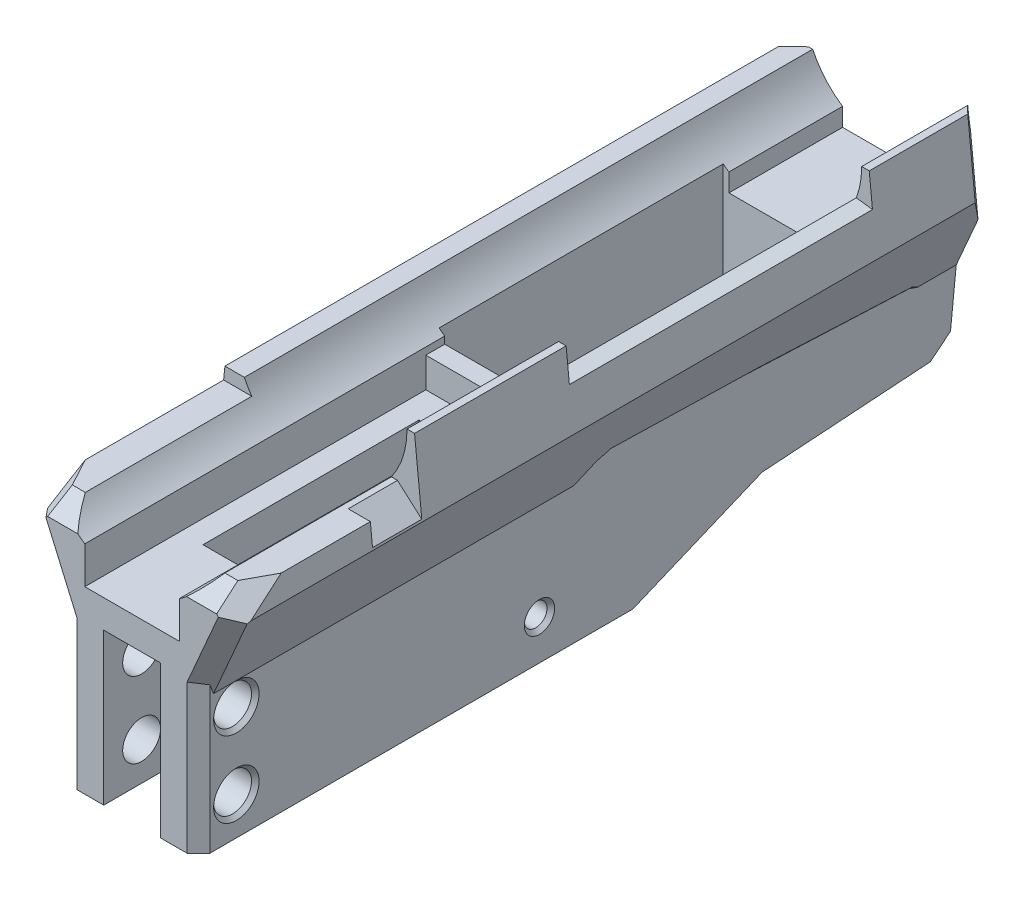
from build123d import *
from OCP.BRepFilletAPI import BRepFilletAPI_MakeChamfer

# Parameters (mm, degrees)
EXTRUDE_1_DEPTH           = 90
SKETCH_3_W                = 13
SKETCH_3_H                = 57
CUT_EXTRUDE_1_DEPTH       = 45
CUT_EXTRUDE_2_REACH       = 121.225
SKETCH_4_W                = 13
SKETCH_4_H                = 26
CHAMFER_1_SIZE            = 3
CUT_EXTRUDE_3_DEPTH       = 121.740424051
CUT_EXTRUDE_3_DEPTH_BACK  = 121.740424051
SKETCH_5_W                = 50
SKETCH_5_H                = 13
CUT_EXTRUDE_5_DEPTH       = 13
EXTRUDE_START             = 80
EXTRUDE_3_DEPTH           = 80
EXTRUDE_START_2           = 30
EXTRUDE_4_DEPTH           = 30
CUT_EXTRUDE_7_REACH       = 138.302
SKETCH_13_W               = 28
SKETCH_13_H               = 75
SKETCH_14_W               = 10
SKETCH_14_H               = 29.16112988
CUT_EXTRUDE_8_DEPTH       = 5
SKETCH_15_R               = 2
CUT_EXTRUDE_9_DEPTH       = 141.755106479
SKETCH_16_R               = 3
CUT_EXTRUDE_10_DEPTH      = 14
CUT_EXTRUDE_START         = -14
SKETCH_17_R               = 3
CUT_EXTRUDE_11_DEPTH      = 14
CUT_EXTRUDE_12_DEPTH      = 137.302054277
CUT_EXTRUDE_12_DEPTH_BACK = 137.302054277
CHAMFER_2_SIZE            = 4.4
CHAMFER_2_SIZE2           = 6.05608045
CUT_EXTRUDE_13_DEPTH      = 10
CHAMFER_3_SIZE            = 2
CHAMFER_4_SIZE            = 4
CHAMFER_4_SIZE2           = 4.917507249
CHAMFER_5_SIZE            = 4
CHAMFER_5_EDGE_2_SIZE     = 4
CHAMFER_5_EDGE_3_SIZE     = 4
CHAMFER_5_EDGE_3_SIZE2    = 4.372547618
CHAMFER_5_EDGE_4_SIZE     = 4
CHAMFER_5_EDGE_4_SIZE2    = 4.372547618
CHAMFER_5_EDGE_5_SIZE     = 4
CHAMFER_5_EDGE_6_SIZE     = 4
SKETCH_25_W               = 20
SKETCH_25_H               = 40
CUT_EXTRUDE_14_DEPTH      = 7.5
SKETCH_26_R               = 5
SKETCH_26_W               = 15
SKETCH_26_H               = 10
CUT_EXTRUDE_15_DEPTH      = 20
CHAMFER_6_SIZE            = 1
CHAMFER_6_SIZE2           = 0.909876415
SKETCH_28_R               = 5
CUT_EXTRUDE_16_DEPTH      = 141.755106479
CHAMFER_7_SIZE            = 1
CHAMFER_8_SIZE            = 3


# Some blends are built 0.0001 mm under size
with BuildPart() as part:
    # 스케치2 → 보스-돌출1 (new body)
    with BuildSketch(Plane.XY):
        with BuildLine():
            ThreePointArc((20.380730277, -9.650302243), (17.060788125, -14.745575898), (12.5, -18.768390981))
            Line((12.5, -18.768390981), (12.5, -28.568390981))
            Line((12.5, -28.568390981), (-12.5, -28.568390981))
            Line((-12.5, -28.568390981), (-12.5, -18.768390981))
            ThreePointArc((-12.5, -18.768390981), (-17.060788125, -14.745575898), (-20.380730277, -9.650302243))
            Line((-20.380730277, -9.650302243), (-25.518665511, -9.650302243))
            Line((-25.518665511, -9.650302243), (-26.5, -19.300604486))
            Line((-26.5, -19.300604486), (-17.5, -40))
            Line((-17.5, -40), (-17.5, -76))
            Line((-17.5, -76), (17.5, -76))
            Line((17.5, -76), (17.5, -40))
            Line((17.5, -40), (26.5, -19.300604486))
            Line((26.5, -19.300604486), (24.537331021, 0))
            Line((24.537331021, 0), (22.55, 0))
            ThreePointArc((22.55, 0), (22.000999611, -4.945555189), (20.380730277, -9.650302243))
        make_face()
    extrude(amount=EXTRUDE_1_DEPTH)

    # 스케치3 → 컷-돌출1 (cut)
    with BuildSketch(Plane(origin=(0, -28.568390981, 0), x_dir=(1, 0, 0), z_dir=(0, 1, 0))):
        with Locations((0, -36.3)):
            Rectangle(SKETCH_3_W, SKETCH_3_H)
    extrude(amount=-CUT_EXTRUDE_1_DEPTH, mode=Mode.SUBTRACT)

    # 스케치4 → 컷-돌출2 (cut, up to next)
    with BuildSketch(Plane(origin=(0, -73.568390981, 0), x_dir=(1, 0, 0), z_dir=(0, 1, 0)), mode=Mode.PRIVATE) as cut_extrude_2_sk1:
        with Locations((0, -37)):
            Rectangle(SKETCH_4_W, SKETCH_4_H)
    cut_extrude_2_tool1 = extrude(cut_extrude_2_sk1.sketch, amount=-CUT_EXTRUDE_2_REACH, mode=Mode.PRIVATE) & part.part
    add(cut_extrude_2_tool1.solids().sort_by_distance((0, -73.568391, 37))[0], mode=Mode.SUBTRACT)

    # 모따기1
    # the kernel refuses this chamfer: 3 mm, written as the material it takes off along each edge
    with BuildSketch(Plane(origin=(6.5, -76, 24), x_dir=(0, -0.027495876610586768, -0.9996219169112968), z_dir=(-1, 0, 0)), Plane(origin=(-6.5, -76, 50), x_dir=(0, -0.027495876610586768, 0.9996219169112968), z_dir=(1, 0, 0))) as chamfer_1_piece_1:
        Polygon((CHAMFER_1_SIZE * 0.999621916911, -CHAMFER_1_SIZE * 0.0274958766106), (-CHAMFER_1_SIZE * 0.0274958766106, -CHAMFER_1_SIZE * 0.999621916911), (0, 0), align=None)
    extrude(amount=13, mode=Mode.SUBTRACT)

    # 스케치5 → 컷-돌출3 (cut, two sides: drawn at the far end of the back side and taken through both)
    with BuildSketch(Plane(origin=(0, 0, 0), x_dir=(0, 0, -1), z_dir=(1, 0, 0)).offset(-CUT_EXTRUDE_3_DEPTH_BACK)):
        with Locations((-65, -6.5)):
            Rectangle(SKETCH_5_W, SKETCH_5_H)
    extrude(amount=CUT_EXTRUDE_3_DEPTH + CUT_EXTRUDE_3_DEPTH_BACK, mode=Mode.SUBTRACT)

    # 스케치7 → 컷-돌출5 (cut)
    with BuildSketch(Plane.XY.offset(40)):
        Polygon((20.020200806, -13), (26.436113625, -18.672355064), (25.859294628, -13), align=None)
    extrude(amount=CUT_EXTRUDE_5_DEPTH, mode=Mode.SUBTRACT)

    # 스케치9 → 보스-돌출3 (add)
    with BuildSketch(Plane(origin=(0, 0, 0), x_dir=(-1, 0, 0), z_dir=(0, 0, -1)).offset(EXTRUDE_START)):
        with BuildLine():
            Line((-25.393724686, -8.421652141), (-21.139272206, -7.850711472))
            ThreePointArc((-21.139272206, -7.850711472), (-17.683299751, -13.992977164), (-12.5, -18.768390981))
            Line((-12.5, -18.768390981), (-12.5, -20.639392703))
            Line((-12.5, -20.639392703), (12.5, -20.639392703))
            Line((12.5, -20.639392703), (12.5, -18.768390981))
            ThreePointArc((12.5, -18.768390981), (17.060788125, -14.745575898), (20.380730277, -9.650302243))
            Line((20.380730277, -9.650302243), (25.518665511, -9.650302243))
            Line((25.518665511, -9.650302243), (26.5, -19.300604486))
            Line((26.5, -19.300604486), (17.5, -40))
            Line((17.5, -40), (17.5, -76))
            Line((17.5, -76), (-17.5, -76))
            Line((-17.5, -76), (-17.5, -40))
            Line((-17.5, -40), (-26.5, -19.300604486))
            Line((-26.5, -19.300604486), (-25.393724686, -8.421652141))
        make_face()
    extrude(amount=-EXTRUDE_3_DEPTH)

    # 스케치12 → 보스-돌출4 (add)
    with BuildSketch(Plane(origin=(0, 0, -80), x_dir=(-1, 0, 0), z_dir=(0, 0, -1)).offset(EXTRUDE_START_2)):
        with BuildLine():
            Line((-12.5, -23.568390981), (12.5, -23.568390981))
            Line((12.5, -23.568390981), (12.5, -18.768390981))
            ThreePointArc((12.5, -18.768390981), (17.060788125, -14.745575898), (20.380730277, -9.650302243))
            Line((20.380730277, -9.650302243), (25.518665511, -9.650302243))
            Line((25.518665511, -9.650302243), (26.5, -19.300604486))
            Line((26.5, -19.300604486), (17.5, -40))
            Line((17.5, -40), (17.5, -76))
            Line((17.5, -76), (-17.5, -76))
            Line((-17.5, -76), (-17.5, -40))
            Line((-17.5, -40), (-26.5, -19.300604486))
            Line((-26.5, -19.300604486), (-25.393724686, -8.421652141))
            Line((-25.393724686, -8.421652141), (-24.537331021, 0))
            Line((-24.537331021, 0), (-22.55, 0))
            ThreePointArc((-22.55, 0), (-22.194516082, -3.98822716), (-21.139272206, -7.850711472))
            ThreePointArc((-21.139272206, -7.850711472), (-17.683299751, -13.992977164), (-12.5, -18.768390981))
            Line((-12.5, -18.768390981), (-12.5, -23.568390981))
        make_face()
    extrude(amount=-EXTRUDE_4_DEPTH)

    # 컷-돌출7: up to this face of the body (flat: up to its plane)
    cut_extrude_7_end = Plane(part.part.faces().sort_by_distance((23.266498446, -8.136181806, -40))[0])
    # 스케치13 → 컷-돌출7 (cut, up to the picked face)
    with BuildSketch(Plane.XZ.offset(76), mode=Mode.PRIVATE) as cut_extrude_7_sk1:
        with Locations((0, -42.5)):
            Rectangle(SKETCH_13_W, SKETCH_13_H)
    cut_extrude_7_tool1 = split(extrude(cut_extrude_7_sk1.sketch, amount=-CUT_EXTRUDE_7_REACH, mode=Mode.PRIVATE), bisect_by=cut_extrude_7_end, keep=Keep.BOTH, mode=Mode.PRIVATE)
    add(cut_extrude_7_tool1.solids().sort_by(Axis((0, -76, -42.5), (0, 1, 0)))[0], mode=Mode.SUBTRACT)

    # 스케치14 → 컷-돌출8 (cut, symmetric)
    with BuildSketch(Plane(origin=(0, 0, 0), x_dir=(0, 0, -1), z_dir=(1, 0, 0))):
        with Locations((0, -61.41943506)):
            Rectangle(SKETCH_14_W, SKETCH_14_H)
    extrude(amount=CUT_EXTRUDE_8_DEPTH, both=True, mode=Mode.SUBTRACT)

    # 스케치15 → 컷-돌출9 (cut, through all)
    with BuildSketch(Plane(origin=(17.5, 0, 0), x_dir=(0, 0, -1), z_dir=(1, 0, 0))):
        with Locations(Location((0, -65.470889295, 0), (0, 0, 90))):
            Circle(SKETCH_15_R)
    extrude(amount=-CUT_EXTRUDE_9_DEPTH, mode=Mode.SUBTRACT)

    # 스케치16 → 컷-돌출10 (cut)
    with BuildSketch(Plane(origin=(17.5, 0, 0), x_dir=(0, 0, -1), z_dir=(1, 0, 0))):
        with Locations(Location((0, -65.470889295, 0), (0, 0, 90))):
            Circle(SKETCH_16_R)
    extrude(amount=-CUT_EXTRUDE_10_DEPTH, mode=Mode.SUBTRACT)

    # 스케치17 → 컷-돌출11 (cut)
    with BuildSketch(Plane.ZY.offset(17.5).offset(CUT_EXTRUDE_START)):
        with Locations(Location((0, -65.470889295, 0), (0, 0, 90))):
            Circle(SKETCH_17_R)
    extrude(amount=CUT_EXTRUDE_11_DEPTH, mode=Mode.SUBTRACT)

    # 스케치20 → 컷-돌출12 (cut, two sides: drawn at the far end of the back side and taken through both)
    with BuildSketch(Plane(origin=(0, 0, 0), x_dir=(0, 0, -1), z_dir=(1, 0, 0)).offset(-CUT_EXTRUDE_12_DEPTH_BACK)):
        Polygon((24.638134981, -76), (58.770788474, -61.759843807), (108.06507615, -58.409570701), (110, -40), (110, -58.885675635), (110, -79), align=None)
    extrude(amount=CUT_EXTRUDE_12_DEPTH + CUT_EXTRUDE_12_DEPTH_BACK, mode=Mode.SUBTRACT)

    # 모따기2
    chamfer_2_edges = [part.edges().sort_by_distance(p)[0] for p in [
        (22.142444121, -13, 90),
        (-22.142444121, -13, 90),
    ]]
    chamfer_2_side = [part.faces().sort_by_distance(p)[0] for p in [
        (0, -46.360145524, 90),
    ]]
    chamfer(chamfer_2_edges, length=CHAMFER_2_SIZE, length2=CHAMFER_2_SIZE2, reference=chamfer_2_side[0])

    # 스케치22 → 컷-돌출13 (cut)
    with BuildSketch(Plane(origin=(17.5, 0, 0), x_dir=(0, 0, -1), z_dir=(1, 0, 0))):
        Polygon((5, -40), (16.187664279, -33.618483394), (97.983053558, -37.257986642), (105.827326917, -40), align=None)
    cut_extrude_13 = extrude(amount=CUT_EXTRUDE_13_DEPTH, mode=Mode.SUBTRACT)

    # 대칭 복사1: 컷-돌출13 across plane
    add(cut_extrude_13.mirror(Plane(origin=(0, 0, 0), x_dir=(0, 0, 1), z_dir=(1, 0, 0))), mode=Mode.SUBTRACT)

    # 모따기3
    # the kernel refuses this chamfer: 2 mm, written as the material it adds along each edge
    with BuildSketch(Plane(origin=(-17.5, -42.54838117, -0.532342115), x_dir=(0.02749587661058563, -0.8682969012521734, -0.4952822105075944), z_dir=(0, 0.4954695391613189, -0.8686253137937383))) as chamfer_3_piece_1_section:
        Polygon((CHAMFER_3_SIZE * 0.999621916911, CHAMFER_3_SIZE * 0.0274958766106), (-CHAMFER_3_SIZE * 0.0274958766106, CHAMFER_3_SIZE * 0.999621916911), (0, 0), align=None)
    chamfer_3_piece_1 = extrude(amount=23.166467438, mode=Mode.PRIVATE)
    chamfer_3_piece_1 = split(chamfer_3_piece_1, bisect_by=Plane(origin=(-18.981499347, -36.592651008, -13.119815706), z_dir=(0.9170657984648163, 0.39873590418482396, 0)), keep=Keep.TOP, mode=Mode.PRIVATE)
    add(chamfer_3_piece_1)
    with BuildSketch(Plane(origin=(-17.5, -33.389854441, -11.049382234), x_dir=(0.027495876610585623, -0.9986338461144253, 0.04443442543935536), z_dir=(0, -0.04445123169833253, -0.9990115554889749))) as chamfer_3_piece_2_section:
        Polygon((CHAMFER_3_SIZE * 0.999621916911, CHAMFER_3_SIZE * 0.0274958766106), (-CHAMFER_3_SIZE * 0.0274958766106, CHAMFER_3_SIZE * 0.999621916911), (0, 0), align=None)
    chamfer_3_piece_2 = extrude(amount=92.16305143, mode=Mode.PRIVATE)
    chamfer_3_piece_2 = split(chamfer_3_piece_2, bisect_by=Plane(origin=(-19.031912041, -36.476705196, -55.876070021), z_dir=(0.9170657984648163, 0.39873590418482396, 0)), keep=Keep.TOP, mode=Mode.PRIVATE)
    add(chamfer_3_piece_2)
    with BuildSketch(Plane(origin=(-17.5, -35.560793827, -93.127772916), x_dir=(0.02749587661058555, -0.9436320427706771, 0.3298523072919975), z_dir=(0, -0.3299770660403273, -0.9439889490282275))) as chamfer_3_piece_3_section:
        Polygon((CHAMFER_3_SIZE * 0.999621916911, CHAMFER_3_SIZE * 0.0274958766106), (-CHAMFER_3_SIZE * 0.0274958766106, CHAMFER_3_SIZE * 0.999621916911), (0, 0), align=None)
    chamfer_3_piece_3 = extrude(amount=18.596440839, mode=Mode.PRIVATE)
    chamfer_3_piece_3 = split(chamfer_3_piece_3, bisect_by=Plane(origin=(-18.228365735, -38.32480773, -98.041579584), z_dir=(0.9170657984648163, 0.39873590418482396, 0)), keep=Keep.TOP, mode=Mode.PRIVATE)
    add(chamfer_3_piece_3)
    with BuildSketch(Plane(origin=(17.5, -35.560793827, -93.127772916), x_dir=(-0.027495876610583912, -0.9436320427706772, 0.3298523072919975), z_dir=(0, -0.3299770660403273, -0.9439889490282275))) as chamfer_3_piece_4_section:
        Polygon((CHAMFER_3_SIZE * 0.999621916911, -CHAMFER_3_SIZE * 0.0274958766106), (-CHAMFER_3_SIZE * 0.0274958766106, -CHAMFER_3_SIZE * 0.999621916911), (0, 0), align=None)
    chamfer_3_piece_4 = extrude(amount=18.596440839, mode=Mode.PRIVATE)
    chamfer_3_piece_4 = split(chamfer_3_piece_4, bisect_by=Plane(origin=(18.228365735, -38.32480773, -98.041579584), z_dir=(-0.9170657984648163, 0.39873590418482396, 0)), keep=Keep.TOP, mode=Mode.PRIVATE)
    add(chamfer_3_piece_4)
    with BuildSketch(Plane(origin=(17.5, -33.389854441, -11.049382234), x_dir=(-0.027495876610585716, -0.9986338461144253, 0.04443442543935535), z_dir=(0, -0.04445123169833253, -0.9990115554889749))) as chamfer_3_piece_5_section:
        Polygon((CHAMFER_3_SIZE * 0.999621916911, -CHAMFER_3_SIZE * 0.0274958766106), (-CHAMFER_3_SIZE * 0.0274958766106, -CHAMFER_3_SIZE * 0.999621916911), (0, 0), align=None)
    chamfer_3_piece_5 = extrude(amount=92.16305143, mode=Mode.PRIVATE)
    chamfer_3_piece_5 = split(chamfer_3_piece_5, bisect_by=Plane(origin=(19.031912041, -36.476705196, -55.876070021), z_dir=(-0.9170657984648163, 0.39873590418482396, 0)), keep=Keep.TOP, mode=Mode.PRIVATE)
    add(chamfer_3_piece_5)
    with BuildSketch(Plane(origin=(17.5, -42.54838117, -0.532342115), x_dir=(-0.027495876610583985, -0.8682969012521733, -0.4952822105075944), z_dir=(0, 0.4954695391613189, -0.8686253137937383))) as chamfer_3_piece_6_section:
        Polygon((CHAMFER_3_SIZE * 0.999621916911, -CHAMFER_3_SIZE * 0.0274958766106), (-CHAMFER_3_SIZE * 0.0274958766106, -CHAMFER_3_SIZE * 0.999621916911), (0, 0), align=None)
    chamfer_3_piece_6 = extrude(amount=23.166467438, mode=Mode.PRIVATE)
    chamfer_3_piece_6 = split(chamfer_3_piece_6, bisect_by=Plane(origin=(18.981499347, -36.592651008, -13.119815706), z_dir=(-0.9170657984648163, 0.39873590418482396, 0)), keep=Keep.TOP, mode=Mode.PRIVATE)
    add(chamfer_3_piece_6)

    # 모따기4
    chamfer_4_edges = [part.edges().sort_by_distance(p)[0] for p in [
        (0, -58.409570701, -108.06507615),
    ]]
    chamfer_4_side = [part.faces().sort_by_distance(p)[0] for p in [
        (0, -49.20478535, -109.032538075),
    ]]
    chamfer(chamfer_4_edges, length=CHAMFER_4_SIZE, length2=CHAMFER_4_SIZE2, reference=chamfer_4_side[0])

    # 모따기5
    chamfer_5_edges = [part.edges().sort_by_distance(p)[0] for p in [
        (-26.009332755, -14.475453365, -110),
    ]]
    chamfer(chamfer_5_edges, length=CHAMFER_5_SIZE)

    # 모따기5 edge 2
    chamfer_5_edge_2_edges = [part.edges().sort_by_distance(p)[0] for p in [
        (25.518665511, -9.650302243, -110),
    ]]
    chamfer(chamfer_5_edge_2_edges, length=CHAMFER_5_EDGE_2_SIZE)

    # 모따기5 edge 3
    chamfer_5_edge_3_edges = [part.edges().sort_by_distance(p)[0] for p in [
        (26.083011546, -15.2, 86.971959775),
    ]]
    chamfer_5_edge_3_side = [part.faces().sort_by_distance(p)[0] for p in [
        (21.25365505, -15.373477723, 87.210731376),
    ]]
    chamfer(chamfer_5_edge_3_edges, length=CHAMFER_5_EDGE_3_SIZE, length2=CHAMFER_5_EDGE_3_SIZE2, reference=chamfer_5_edge_3_side[0])

    # 모따기5 edge 4
    chamfer_5_edge_4_edges = [part.edges().sort_by_distance(p)[0] for p in [
        (-26.083011546, -15.2, 86.971959775),
    ]]
    chamfer_5_edge_4_side = [part.faces().sort_by_distance(p)[0] for p in [
        (-21.25365505, -15.373477723, 87.210731376),
    ]]
    chamfer(chamfer_5_edge_4_edges, length=CHAMFER_5_EDGE_4_SIZE, length2=CHAMFER_5_EDGE_4_SIZE2, reference=chamfer_5_edge_4_side[0])

    # 모따기5 edge 5
    chamfer_5_edge_5_edges = [part.edges().sort_by_distance(p)[0] for p in [
        (-22, -29.650302243, 90),
    ]]
    chamfer(chamfer_5_edge_5_edges, length=CHAMFER_5_EDGE_5_SIZE)

    # 모따기5 edge 6
    chamfer_5_edge_6_edges = [part.edges().sort_by_distance(p)[0] for p in [
        (22, -29.650302243, 90),
    ]]
    chamfer(chamfer_5_edge_6_edges, length=CHAMFER_5_EDGE_6_SIZE)

    # 스케치25 → 컷-돌출14 (cut, symmetric)
    with BuildSketch(Plane(origin=(0, 0, 0), x_dir=(0, 0, -1), z_dir=(1, 0, 0))):
        with Locations((-80, -56)):
            Rectangle(SKETCH_25_W, SKETCH_25_H)
    extrude(amount=CUT_EXTRUDE_14_DEPTH, both=True, mode=Mode.SUBTRACT)

    # 스케치26 → 컷-돌출15 (cut)
    with BuildSketch(Plane(origin=(0, 0, -110), x_dir=(-1, 0, 0), z_dir=(0, 0, -1))):
        with Locations((-10, -32)):
            Circle(SKETCH_26_R)
        with Locations(Location((10, -32, 0), (0, 0, 180))):
            Circle(SKETCH_26_R)
        with Locations((0, -45)):
            Rectangle(SKETCH_26_W, SKETCH_26_H)
    extrude(amount=-CUT_EXTRUDE_15_DEPTH, mode=Mode.SUBTRACT)

    # 모따기6: one chamfer whose edges measure the first distance from different faces: ONE call of the kernel's chamfer builder (chamfer() names one face for all edges)
    chamfer_6_edges_1 = [part.edges().sort_by_distance(p)[0] for p in [
        (15, -32, -110),
        (-15, -32, -110),
        (7.5, -45, -109.474478824),
        (-7.5, -45, -109.474478824),
    ]]
    chamfer_6_edges_2 = [part.edges().sort_by_distance(p)[0] for p in [
        (0, -50, -108.948957647),
    ]]
    chamfer_6_side_2 = [part.faces().sort_by_distance(p)[0] for p in [
        (0, -50, -99.474478824),
    ]]
    chamfer_6 = BRepFilletAPI_MakeChamfer(part.part.solid().wrapped)
    for e in chamfer_6_edges_1:
        chamfer_6.Add(CHAMFER_6_SIZE, e.wrapped)
    for e in chamfer_6_edges_2:
        chamfer_6.Add(CHAMFER_6_SIZE, CHAMFER_6_SIZE2, e.wrapped, chamfer_6_side_2[0].wrapped)  # the first distance lies on this face
    add(Compound.cast(chamfer_6.Shape()), mode=Mode.REPLACE)

    # 스케치28 → 컷-돌출16 (cut, through all)
    with BuildSketch(Plane(origin=(17.5, 0, 0), x_dir=(0, 0, -1), z_dir=(1, 0, 0))):
        with Locations(Location((-80, -46, 0), (0, 0, 90))):
            Circle(SKETCH_28_R)
        with Locations(Location((-80, -66, 0), (0, 0, 90))):
            Circle(SKETCH_28_R)
    extrude(amount=-CUT_EXTRUDE_16_DEPTH, mode=Mode.SUBTRACT)

    # 모따기7
    chamfer_7_edges = [part.edges().sort_by_distance(p)[0] for p in [
        (17.5, -68.470889295, 0),
        (-17.5, -68.470889295, 0),
        (-17.5, -51, 80),
        (17.5, -51, 80),
        (-17.5, -71, 80),
        (17.5, -71, 80),
    ]]
    chamfer(chamfer_7_edges, length=CHAMFER_7_SIZE - 0.0001)  # a hair under: the kernel refuses the full size

    # 모따기8
    chamfer_8_edges = [part.edges().sort_by_distance(p)[0] for p in [
        (-17.5, -52.984148708, 90),
        (17.5, -52.984148708, 90),
    ]]
    chamfer(chamfer_8_edges, length=CHAMFER_8_SIZE)


solid = part.part
